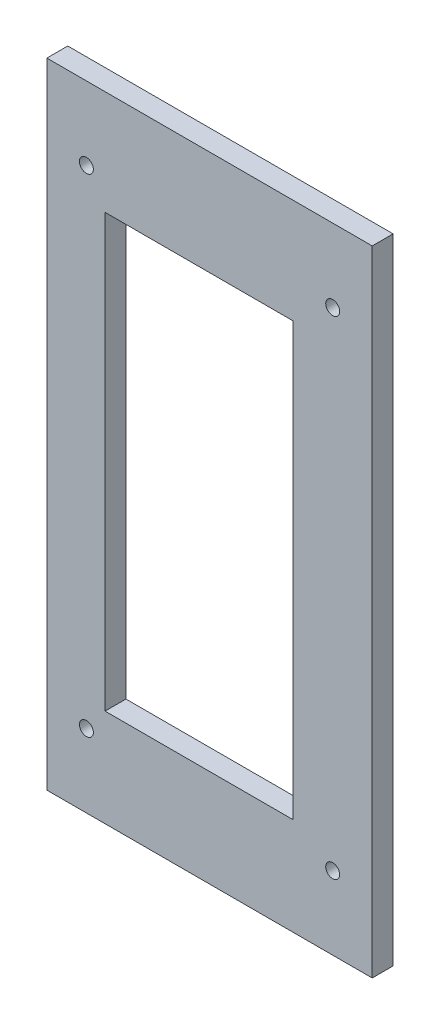
from build123d import *

# Parameters (mm, degrees)
SKETCH1_W           = 46.7
SKETCH1_H           = 91
SKETCH1_R           = 1
SKETCH1_W_2         = 27
SKETCH1_H_2         = 62
BOSS_EXTRUDE1_DEPTH = 3


with BuildPart() as part:
    # Sketch1 → Boss-Extrude1 (new body)
    with BuildSketch(Plane.XY):
        Rectangle(SKETCH1_W, SKETCH1_H)
        with Locations((17.675, 35)):
            Circle(SKETCH1_R, mode=Mode.SUBTRACT)
        with Locations((17.675, -35)):
            Circle(SKETCH1_R, mode=Mode.SUBTRACT)
        with Locations((-17.675, 35)):
            Circle(SKETCH1_R, mode=Mode.SUBTRACT)
        with Locations((-17.675, -35)):
            Circle(SKETCH1_R, mode=Mode.SUBTRACT)
        with Locations((-1.5, -0.5)):
            Rectangle(SKETCH1_W_2, SKETCH1_H_2, mode=Mode.SUBTRACT)
    extrude(amount=BOSS_EXTRUDE1_DEPTH)


solid = part.part
